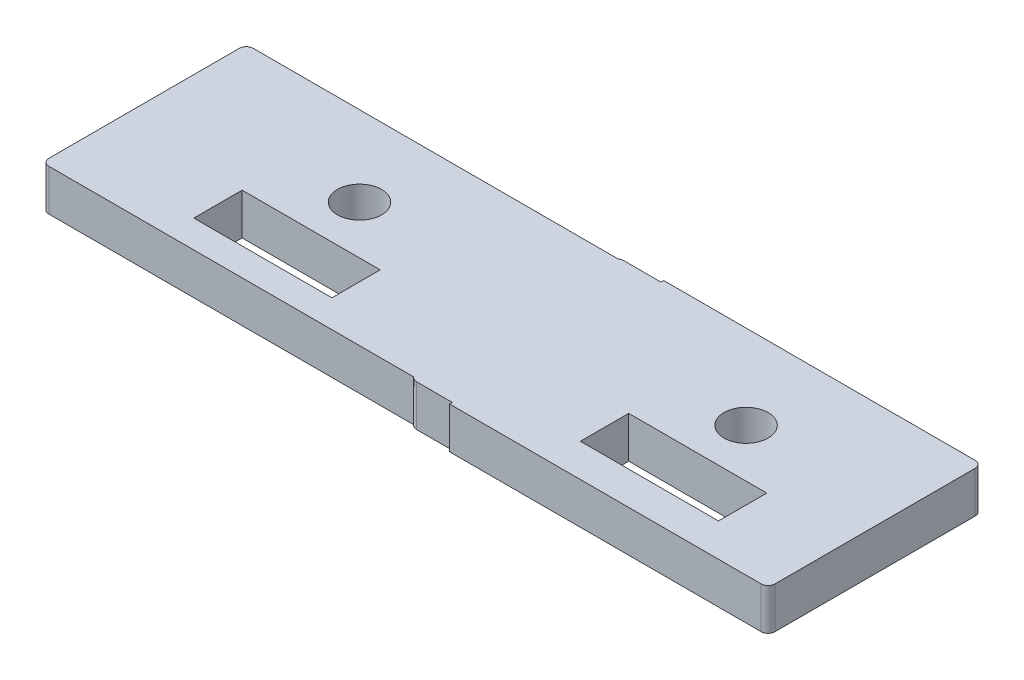
from build123d import *

# Parameters (mm, degrees)
CROQUIS1_W              = 150
CROQUIS1_H              = 30
SALIENTE_EXTRUIR1_DEPTH = 3
CROQUIS2_R              = 1.6
CROQUIS2_W              = 10
CROQUIS2_H              = 3.5
CORTAR_EXTRUIR1_DEPTH   = 77.544104933
CORTAR_EXTRUIR2_START   = -10
CROQUIS3_R              = 1.6
CROQUIS3_W              = 10
CROQUIS3_H              = 3.5
CORTAR_EXTRUIR2_DEPTH   = 10
CROQUIS4_W              = 26.059818974
CROQUIS4_H              = 3
SALIENTE_EXTRUIR2_DEPTH = 0.2
CROQUIS6_W              = 23.059818974
CROQUIS6_H              = 3
SALIENTE_EXTRUIR4_DEPTH = 0.2
CROQUIS7_W              = 23.059818974
CROQUIS7_H              = 3
SALIENTE_EXTRUIR5_DEPTH = 0.2
REDONDEO1_R             = 0.5


with BuildPart() as part:
    # Croquis1 → Saliente-Extruir1 (new body)
    with BuildSketch(Plane(origin=(0, 0, 0), x_dir=(1, 0, 0), z_dir=(0, 1, 0))):
        Rectangle(CROQUIS1_W, CROQUIS1_H)
    extrude(amount=SALIENTE_EXTRUIR1_DEPTH)

    # Croquis2 → Cortar-Extruir1 (cut, through all)
    with BuildSketch(Plane(origin=(0, 3, 0), x_dir=(1, 0, 0), z_dir=(0, 1, 0))):
        with Locations(Location((61, -6, 0), (0, 0, 270))):
            Circle(CROQUIS2_R)
        with Locations(Location((33, -6, 0), (0, 0, 270))):
            Circle(CROQUIS2_R)
        with Locations(Location((-33, -6, 0), (0, 0, 90))):
            Circle(CROQUIS2_R)
        with Locations(Location((-61, -6, 0), (0, 0, 90))):
            Circle(CROQUIS2_R)
        with Locations((61, -11.25)):
            Rectangle(CROQUIS2_W, CROQUIS2_H)
        with Locations((33, -11.25)):
            Rectangle(CROQUIS2_W, CROQUIS2_H)
        with Locations((-33, -11.25)):
            Rectangle(CROQUIS2_W, CROQUIS2_H)
        with Locations((-61, -11.25)):
            Rectangle(CROQUIS2_W, CROQUIS2_H)
    extrude(amount=-CORTAR_EXTRUIR1_DEPTH, mode=Mode.SUBTRACT)

    # Croquis3 → Cortar-Extruir2 (cut)
    with BuildSketch(Plane.XZ.offset(CORTAR_EXTRUIR2_START)):
        Polygon((-48.06783131, 0.2), (-75, 0.2), (-75, -15), (75, -15), (75, 15), (-22.008012336, 15), (-22.008012336, 0.1), (-48.06783131, 0.1), align=None)
        with Locations((33, 6)):
            Circle(CROQUIS3_R, mode=Mode.SUBTRACT)
        with Locations((61, 6)):
            Circle(CROQUIS3_R, mode=Mode.SUBTRACT)
        with Locations((33, 11.25)):
            Rectangle(CROQUIS3_W, CROQUIS3_H, mode=Mode.SUBTRACT)
        with Locations((61, 11.25)):
            Rectangle(CROQUIS3_W, CROQUIS3_H, mode=Mode.SUBTRACT)
    extrude(amount=CORTAR_EXTRUIR2_DEPTH, mode=Mode.SUBTRACT)

    # Croquis4 → Saliente-Extruir2 (add)
    with BuildSketch(Plane.XY.offset(15)):
        with Locations((-35.037921823, 1.5)):
            Rectangle(CROQUIS4_W, CROQUIS4_H)
    extrude(amount=SALIENTE_EXTRUIR2_DEPTH)

    # Croquis6 → Saliente-Extruir4 (add)
    with BuildSketch(Plane(origin=(0, 0, 0.1), x_dir=(-1, 0, 0), z_dir=(0, 0, -1))):
        with Locations((33.537921823, 1.5)):
            Rectangle(CROQUIS6_W, CROQUIS6_H)
    extrude(amount=SALIENTE_EXTRUIR4_DEPTH)

    # Croquis7 → Saliente-Extruir5 (add)
    with BuildSketch(Plane.XY.offset(15.2)):
        with Locations((-33.537921823, 1.5)):
            Rectangle(CROQUIS7_W, CROQUIS7_H)
    extrude(amount=SALIENTE_EXTRUIR5_DEPTH)

    # Redondeo1
    # the kernel refuses this fillet: 0.5 mm, written as the material it takes off along each edge
    with BuildSketch(Plane(origin=(-48.06783131, 3.75, 0.1), x_dir=(0, 0, 1), z_dir=(0, -1, 0))) as redondeo1_piece_1:
        with BuildLine():
            CenterArc((0.5, -0.3), REDONDEO1_R, 143.130102354, 36.869897646)
            Line((0, -0.3), (-0.01, -0.3))
            Line((-0.01, -0.3), (-0.01, 0))
            Line((-0.01, 0), (0, 0.01))
            ThreePointArc((0, 0.01), (0.05, 0.01), (0.092, 0.006))
            Line((0.092, 0.006), (0.1, 0))
        make_face()
    extrude(amount=4.5, mode=Mode.SUBTRACT)
    with BuildSketch(Plane(origin=(-48.06783131, -1, 15.2), x_dir=(1, 0, 0), z_dir=(0, 1, 0))) as redondeo1_piece_2:
        with BuildLine():
            CenterArc((0.4, 0.5), REDONDEO1_R, 216.869897645, 53.130102355)
            Line((0, 0.2), (-0.008, 0.194))
            ThreePointArc((-0.008, 0.194), (-0.01, 0.1), (-0.01, 0))
            Line((-0.01, 0), (0, -0.01))
            Line((0, -0.01), (0.4, -0.01))
            Line((0.4, -0.01), (0.4, 0))
        make_face()
    extrude(amount=5, mode=Mode.SUBTRACT)
    with BuildSketch(Plane(origin=(-22.008012336, -1.25, 15.4), x_dir=(0, 0, -1), z_dir=(0, 1, 0)), Plane(origin=(-75, -1.25, 15), x_dir=(1, 0, 0), z_dir=(0, 1, 0))) as redondeo1_piece_3:
        with BuildLine():
            CenterArc((REDONDEO1_R, REDONDEO1_R), REDONDEO1_R, 180, 90)
            Line((0, REDONDEO1_R), (-REDONDEO1_R * 0.02, REDONDEO1_R))
            Line((-REDONDEO1_R * 0.02, REDONDEO1_R), (-REDONDEO1_R * 0.02, -REDONDEO1_R * 0.02))
            Line((-REDONDEO1_R * 0.02, -REDONDEO1_R * 0.02), (REDONDEO1_R, -REDONDEO1_R * 0.02))
            Line((REDONDEO1_R, -REDONDEO1_R * 0.02), (REDONDEO1_R, 0))
        make_face()
    extrude(amount=5.5, mode=Mode.SUBTRACT)
    with BuildSketch(Plane(origin=(-22.008012336, 4.25, -0.1), x_dir=(-1, 0, 0), z_dir=(0, -1, 0)), Plane(origin=(-75, 4.25, 0.2), x_dir=(0, 0, 1), z_dir=(0, -1, 0))) as redondeo1_piece_4:
        with BuildLine():
            CenterArc((REDONDEO1_R, -REDONDEO1_R), REDONDEO1_R, 90, 90)
            Line((0, -REDONDEO1_R), (-REDONDEO1_R * 0.02, -REDONDEO1_R))
            Line((-REDONDEO1_R * 0.02, -REDONDEO1_R), (-REDONDEO1_R * 0.02, REDONDEO1_R * 0.02))
            Line((-REDONDEO1_R * 0.02, REDONDEO1_R * 0.02), (REDONDEO1_R, REDONDEO1_R * 0.02))
            Line((REDONDEO1_R, REDONDEO1_R * 0.02), (REDONDEO1_R, 0))
        make_face()
    extrude(amount=5.5, mode=Mode.SUBTRACT)


solid = part.part
